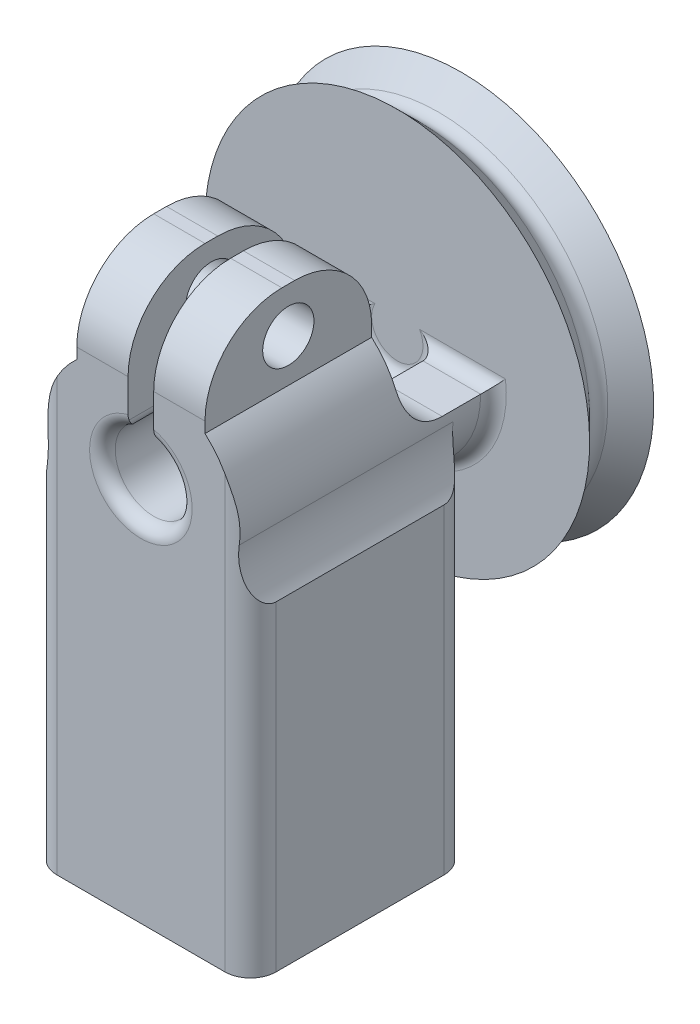
from build123d import *

# Parameters (mm, degrees)
BOSS_EXTRUDE1_DEPTH = 13
FILLET1_R           = 1
FILLET2_R           = 6
BOSS_EXTRUDE2_START = 7
BOSS_EXTRUDE2_DEPTH = 7
SKETCH3_W           = 17.1
SKETCH3_H           = 5
BOSS_EXTRUDE3_DEPTH = 17.1
FILLET3_R           = 6
SKETCH4_W           = 17.1
SKETCH4_H           = 17.1
BOSS_EXTRUDE4_DEPTH = 20
FILLET4_R           = 2
FILLET6_R           = 1
FILLET7_R           = 1
SKETCH6_R           = 1.9999999999999987
CUT_EXTRUDE1_DEPTH  = 14.000000000000002
FILLET8_R           = 3


with BuildPart() as part:
    # Sketch1 → Boss-Extrude1 (new body)
    with BuildSketch(Plane.XY):
        with BuildLine():
            Line((-0.9999999999999998, 7.433034373659251), (-1.0000000000000002, 12.433034373659252))
            Line((-1.0000000000000002, 12.433034373659252), (-5, 12.433034373659252))
            Line((-5, 12.433034373659252), (-4.999999999999999, 5.590169943749475))
            ThreePointArc((-4.999999999999999, 5.590169943749475), (-1.38e-15, -7.5), (4.999999999999999, 5.5901699437494745))
            Line((4.999999999999999, 5.5901699437494745), (5, 12.433034373659252))
            Line((5, 12.433034373659252), (0.9999999999999998, 12.433034373659252))
            Line((0.9999999999999998, 12.433034373659252), (0.9999999999999993, 7.433034373659251))
            Line((0.9999999999999993, 7.433034373659251), (0.9999999999999998, 2.8284271247461907))
            ThreePointArc((0.9999999999999998, 2.8284271247461907), (-5.5e-16, -3.0000000000000004), (-1.0000000000000002, 2.8284271247461903))
            Line((-1.0000000000000002, 2.8284271247461903), (-0.9999999999999998, 7.433034373659251))
        make_face()
    extrude(amount=BOSS_EXTRUDE1_DEPTH)

    # Fillet1
    fillet1_edges = [part.edges().sort_by_distance(p)[0] for p in [
        (-1.0000000000000004, 2.8284271247461907, 6.5),
        (0.9999999999999998, 2.8284271247461907, 6.5),
        (-4.7e-16, -3.0000000000000004, 13),
    ]]
    fillet(fillet1_edges, radius=FILLET1_R)

    # Fillet2
    fillet2_edges = [part.edges().sort_by_distance(p)[0] for p in [
        (-3, 12.433034373659252, 13),
        (3, 12.433034373659252, 0),
        (-3, 12.433034373659252, 0),
        (3, 12.433034373659252, 13),
    ]]
    fillet(fillet2_edges, radius=FILLET2_R)

    # Sketch2 → Boss-Extrude2 (add)
    with BuildSketch(Plane(origin=(0, 0, 0), x_dir=(-1, 0, 0), z_dir=(0, 0, -1)).offset(BOSS_EXTRUDE2_START)):
        with BuildLine():
            Line((-7.5, 0), (-3.0000000000000004, 0))
            ThreePointArc((-3.0000000000000004, 0), (-5.5e-16, -3.0000000000000004), (3.0000000000000004, 0))
            Line((3.0000000000000004, 0), (7.5, 0))
            ThreePointArc((7.5, 0), (-1.38e-15, -7.5), (-7.5, 0))
        make_face()
    extrude(amount=-BOSS_EXTRUDE2_DEPTH)

    # Sketch3 → Boss-Extrude3 (add)
    with BuildSketch(Plane.XY.offset(13)):
        with Locations((1.78e-15, -7.5)):
            Rectangle(SKETCH3_W, SKETCH3_H)
    extrude(amount=-BOSS_EXTRUDE3_DEPTH)

    # Fillet3
    # the kernel refuses this fillet: 6 mm, written as the material it adds along each edge
    with BuildSketch(Plane(origin=(5.590169943749475, -5, 13), x_dir=(0.407962135259343, 0.9129988478605203, 0), z_dir=(0, 0, -1))) as fillet3_piece_1:
        with BuildLine():
            CenterArc((6.396366403246306, 5.714903515427595), FILLET3_R, 210.13883458163096, 42.12773397862901)
            Line((1.2074985897527464, 2.70232143121967), (1.1037212334828754, 2.642069789535512))
            ThreePointArc((1.1037212334828754, 2.642069789535512), (0.4941894331331104, 1.4001161718409558), (-0.10955986174326253, 0.0489554562311212))
            Line((-0.10955986174326253, 0.0489554562311212), (0.03655066516140769, -0.11429807030855153))
            ThreePointArc((0.03655066516140769, -0.11429807030855153), (2.2844165725879635, 0.23637060571550603), (4.5322824800145245, -0.11429807030855171))
            Line((4.5322824800145245, -0.11429807030855171), (4.568833145175932, -9e-17))
        make_face()
    extrude(amount=17.1)
    with BuildSketch(Plane(origin=(-5.590169943749474, -5, 13), x_dir=(-0.40796213525934283, 0.9129988478605204, 0), z_dir=(0, 0, -1))) as fillet3_piece_2:
        with BuildLine():
            CenterArc((6.396366403246302, -5.714903515427596), FILLET3_R, 107.73343143974, 42.12773397862901)
            Line((1.2074985897527435, -2.702321431219668), (1.1037212334828725, -2.642069789535509))
            ThreePointArc((1.1037212334828725, -2.642069789535509), (0.4941894331331094, -1.4001161718409545), (-0.10955986174326254, -0.04895545623112119))
            Line((-0.10955986174326254, -0.04895545623112119), (0.03655066516140771, 0.11429807030855152))
            ThreePointArc((0.03655066516140771, 0.11429807030855152), (2.284416572587965, -0.23637060571550497), (4.532282480014523, 0.11429807030855221))
            Line((4.532282480014523, 0.11429807030855221), (4.56883314517593, 0))
        make_face()
    extrude(amount=17.1)

    # Sketch4 → Boss-Extrude4 (add)
    with BuildSketch(Plane.XZ.offset(10)):
        with Locations((1.78e-15, 4.45)):
            Rectangle(SKETCH4_W, SKETCH4_H)
    extrude(amount=BOSS_EXTRUDE4_DEPTH)

    # Fillet4
    fillet4_edges = [part.edges().sort_by_distance(p)[0] for p in [
        (8.549999999999962, -17.499999999999645, 13),
        (8.549999999999962, -17.499999999999645, -4.100000000000001),
        (-8.54999999999996, -17.499999999999645, 13),
        (-8.54999999999996, -17.499999999999645, -4.100000000000001),
    ]]
    fillet(fillet4_edges, radius=FILLET4_R)

    # Sketch5 → Revolve1 (revolve)
    with BuildSketch(Plane(origin=(0, 0, 0), x_dir=(0, 0, -1), z_dir=(1, 0, 0))):
        Polygon((6.999999999999999, -8.7e-16), (7.000000000000001, -15), (9.499999999999998, -12.5), (12, -15), (12, 0), align=None)
    revolve(axis=Axis((0, 0, 0), (0, -1.2e-16, -1)))

    # Fillet6
    fillet6_edges = [part.edges().sort_by_distance(p)[0] for p in [
        (4.1e-16, -3, -7),
        (5.25, 0, -7),
        (-1.01e-15, -7.499999999999999, -7),
        (-5.25, 0, -7),
    ]]
    fillet(fillet6_edges, radius=FILLET6_R)

    # Fillet7
    fillet7_edges = [part.edges().sort_by_distance(p)[0] for p in [
        (-1.53e-15, 12.499999999999996, -9.500000000000002),
    ]]
    fillet(fillet7_edges, radius=FILLET7_R)

    # Sketch6 → Cut-Extrude1 (cut)
    with BuildSketch(Plane.ZY.offset(4.999999999999998)):
        with Locations(Location((6.500000000000002, 8.942387299959254, 0), (0, 0, 270))):
            Circle(SKETCH6_R)
    extrude(amount=-CUT_EXTRUDE1_DEPTH, mode=Mode.SUBTRACT)

    # Fillet8
    fillet8_edges = [part.edges().sort_by_distance(p)[0] for p in [
        (5.25, 0, 0),
        (-5.25, 0, 0),
    ]]
    fillet(fillet8_edges, radius=FILLET8_R)


solid = part.part
